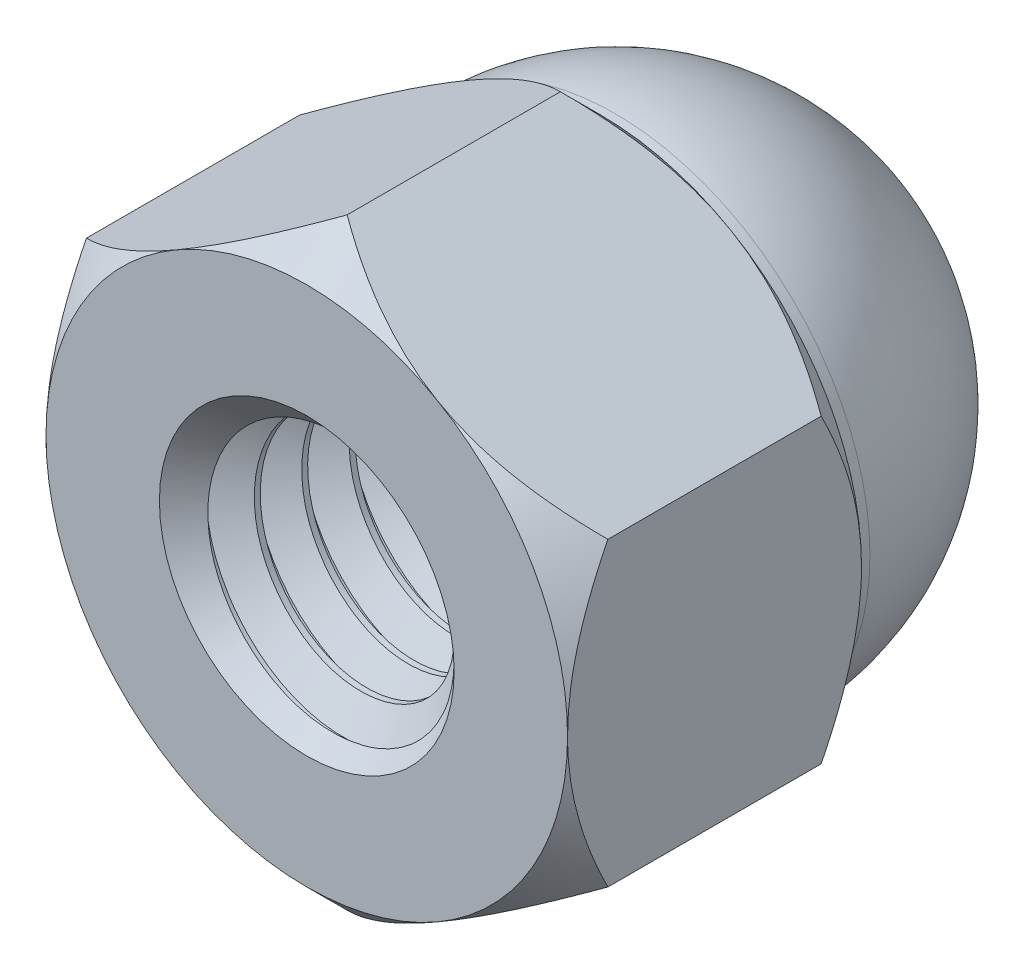
from build123d import *

# Parameters (mm, degrees)
BOSS_EXTRUDE2_DEPTH          = 3.1
SKETCH8_OUTSIDE_W            = 21.732
SKETCH8_OUTSIDE_H            = 22.582
SKETCH8_OUTSIDE_R            = 2.75
CUT_EXTRUDE3_DEPTH           = 6.220711957
CUT_EXTRUDE3_DRAFT           = -45
SKETCH9_OUTSIDE_W            = 21.732
SKETCH9_OUTSIDE_H            = 22.582
SKETCH9_OUTSIDE_R            = 2.75
CUT_EXTRUDE4_DEPTH           = 6.220711957
CUT_EXTRUDE4_DRAFT           = 45
SWEEP1_PITCH                 = 0.5
SWEEP1_HEIGHT                = 4.3
SWEEP1_RADIUS                = 1.5
SWEEP1_START_ANGLE           = 90
SKETCH15_R                   = 1.554126588
CUT_EXTRUDE5_OTHER_WAY_DEPTH = 8.324331716
CUT_EXTRUDE5_OTHER_WAY_TAPER = -45


with BuildPart() as part:
    # Sketch7 → Boss-Extrude2 (new body)
    with BuildSketch(Plane.XY.offset(3)):
        Polygon((0, 3.175426481), (-2.75, 1.58771324), (-2.75, -1.58771324), (0, -3.175426481), (2.75, -1.58771324), (2.75, 1.58771324), align=None)
    extrude(amount=-BOSS_EXTRUDE2_DEPTH)


with BuildPart() as cut_extrude3_tool:
    # Sketch8 outside → Cut-Extrude3 (with draft: the straight prism first)
    with BuildSketch(Plane.XY.offset(3)):
        Rectangle(SKETCH8_OUTSIDE_W, SKETCH8_OUTSIDE_H)
        Circle(SKETCH8_OUTSIDE_R, mode=Mode.SUBTRACT)
    extrude(amount=-CUT_EXTRUDE3_DEPTH)
    # Cut-Extrude3: the draft: its side faces are tilted about the plane it starts from
    cut_extrude3_sides = [cut_extrude3_tool.faces().sort_by_distance(p)[0] for p in [
        (0, -11.291, -0.110355978),
        (10.866, 0, -0.110355978),
        (0, 11.291, -0.110355978),
        (-10.866, 0, -0.110355978),
        (-2.75, 0, -0.110355978),
    ]]
    draft(cut_extrude3_sides, Plane.XY.offset(3), CUT_EXTRUDE3_DRAFT)


with BuildPart() as part_1:
    add(part.part)

    # Cut-Extrude3: cut by cut_extrude3_tool
    add(cut_extrude3_tool.part, mode=Mode.SUBTRACT)


with BuildPart() as cut_extrude4_tool:
    # Sketch9 outside → Cut-Extrude4 (with draft: the straight prism first)
    with BuildSketch(Plane.XY.offset(-0.1)):
        Rectangle(SKETCH9_OUTSIDE_W, SKETCH9_OUTSIDE_H)
        Circle(SKETCH9_OUTSIDE_R, mode=Mode.SUBTRACT)
    extrude(amount=CUT_EXTRUDE4_DEPTH)
    # Cut-Extrude4: the draft: its side faces are tilted about the plane it starts from
    cut_extrude4_sides = [cut_extrude4_tool.faces().sort_by_distance(p)[0] for p in [
        (0, -11.291, 3.010355978),
        (10.866, 0, 3.010355978),
        (0, 11.291, 3.010355978),
        (-10.866, 0, 3.010355978),
        (-2.75, 0, 3.010355978),
    ]]
    draft(cut_extrude4_sides, Plane.XY.offset(-0.1), CUT_EXTRUDE4_DRAFT)


with BuildPart() as part_2:
    add(part_1.part)

    # Cut-Extrude4: cut by cut_extrude4_tool
    add(cut_extrude4_tool.part, mode=Mode.SUBTRACT)

    # Sketch10 → Revolve1 (revolve)
    with BuildSketch(Plane(origin=(0, 0, 0), x_dir=(0, 0, -1), z_dir=(1, 0, 0))):
        with BuildLine():
            Line((0.25, 2.75), (0.1, 2.75))
            Line((0.1, 2.75), (0.1, 0))
            Line((0.1, 0), (3, 0))
            ThreePointArc((3, 0), (2.194543648, 1.944543648), (0.25, 2.75))
        make_face()
    revolve(axis=Axis((0, 0, -3), (0, 0, 1)))

    # Sketch11 → Cut-Revolve1 (revolve, cut)
    with BuildSketch(Plane(origin=(0, 0, 0), x_dir=(0, 0, -1), z_dir=(1, 0, 0)), mode=Mode.PRIVATE) as cut_revolve1_sk:
        Polygon((-3, 0), (-3, 1.5), (0.8, 1.5), (1.201923789, 0), align=None)
    revolve(cut_revolve1_sk.sketch.rotate(Axis((0, 0, -3), (0, 0, 1)), 90), axis=Axis((0, 0, -3), (0, 0, 1)), mode=Mode.SUBTRACT)

    # Sweep1: sweep along a helix
    with BuildLine() as sweep1_path:
        add(Helix(SWEEP1_PITCH, SWEEP1_HEIGHT, SWEEP1_RADIUS, center=(0, 0, 3), direction=(0, 0, -1), mode=Mode.PRIVATE).rotate(Axis((0, 0, 3), (0, 0, -1)), SWEEP1_START_ANGLE))
    # Sketch13 → Sweep1 (sweep)
    with BuildSketch(Plane(origin=(0, 0, 0), x_dir=(0, 0, -1), z_dir=(1, 0, 0))):
        Polygon((-3.453125, 1.527063294), (-3.25, 1.175240474), (-3.1875, 1.175240474), (-2.984375, 1.527063294), align=None)
    sweep(path=sweep1_path.line, is_frenet=True)

    # Sketch14 → Cut-Revolve4 (revolve, cut)
    with BuildSketch(Plane(origin=(0, 0, 0), x_dir=(0, 0, -1), z_dir=(1, 0, 0)), mode=Mode.PRIVATE) as cut_revolve4_sk:
        with BuildLine():
            Line((0.25, 2.689120088), (0.1, 2.689120088))
            Line((0.1, 2.689120088), (0.1, 2.75))
            Line((0.1, 2.75), (0.25, 2.75))
            Line((0.25, 2.75), (3, 2.75))
            Line((3, 2.75), (3.121759824, 2.75))
            Line((3.121759824, 2.75), (3.121759824, 0.75))
            Line((3.121759824, 0.75), (3.121759824, 0))
            Line((3.121759824, 0), (3, 0))
            ThreePointArc((3, 0), (2.173139806, 1.905109375), (0.25, 2.689120088))
        make_face()
    revolve(cut_revolve4_sk.sketch.rotate(Axis((0, 0, -3), (0, 0, 1)), 270), axis=Axis((0, 0, -3), (0, 0, 1)), mode=Mode.SUBTRACT)

    # Cut-Extrude5 cone 1 section (through the dimple's axis) → Cut-Extrude5 (revolve, cut)
    with BuildSketch(Plane(origin=(0, 0, 3), x_dir=(0, -1, 0), z_dir=(1, 0, 0))):
        Polygon((0, 0), (1.554126588, 0), (0, 1.554126588), align=None)
    revolve(axis=Axis((0, 0, 3), (0, 0, -1)), mode=Mode.SUBTRACT)

    # Sketch15 → Cut-Extrude5 other way (cut)
    with BuildSketch(Plane.XY.offset(3)):
        Circle(SKETCH15_R)
    extrude(amount=CUT_EXTRUDE5_OTHER_WAY_DEPTH, taper=CUT_EXTRUDE5_OTHER_WAY_TAPER, mode=Mode.SUBTRACT)


solid = part_2.part
